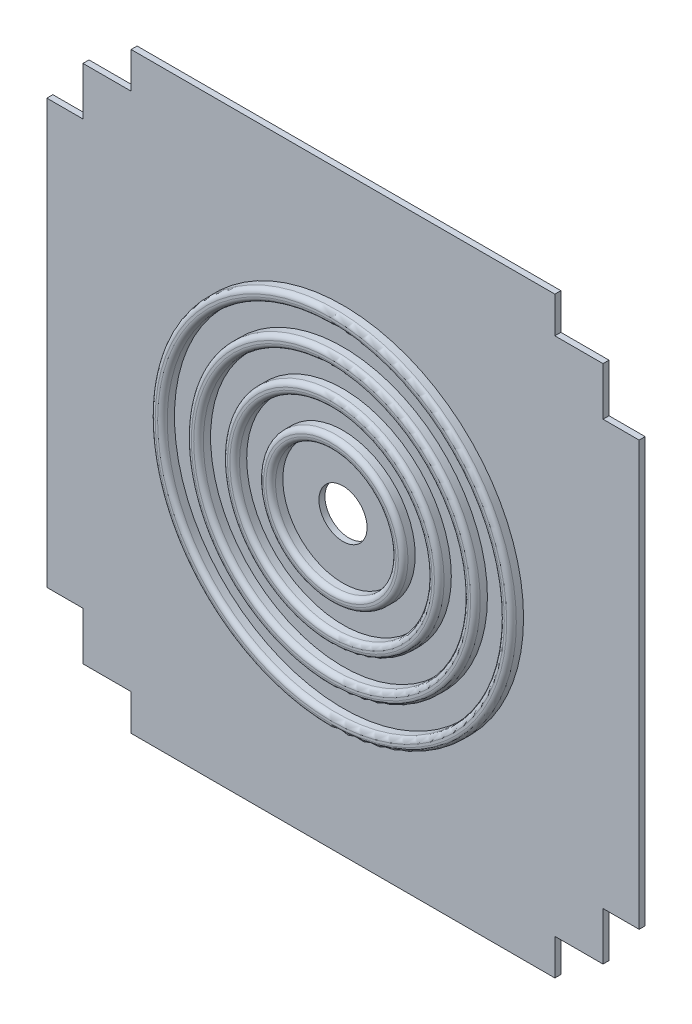
from build123d import *

# Parameters (mm, degrees)
SALIENTE_EXTRUIR1_DEPTH = 5
CROQUIS2_R              = 20
CORTAR_EXTRUIR1_DEPTH   = 10
CROQUIS3_R              = 150
CROQUIS3_R_2            = 140
CROQUIS3_R_3            = 120
CROQUIS3_R_4            = 110
CROQUIS3_R_5            = 90
CROQUIS3_R_6            = 80
CROQUIS3_R_7            = 60
CROQUIS3_R_8            = 50
SALIENTE_EXTRUIR2_DEPTH = 10
REDONDEO1_R             = 4


with BuildPart() as part:
    # Croquis1 → Saliente-Extruir1 (new body)
    with BuildSketch(Plane.XY):
        Polygon((-246, 176), (-246, -176), (-216, -176), (-216, -216), (-176, -216), (-176, -246), (176, -246), (176, -216), (216, -216), (216, -176), (246, -176), (246, 176), (216, 176), (216, 216), (176, 216), (176, 246), (-176, 246), (-176, 216), (-216, 216), (-216, 176), align=None)
    extrude(amount=SALIENTE_EXTRUIR1_DEPTH)

    # Croquis2 → Cortar-Extruir1 (cut)
    with BuildSketch(Plane.XY.offset(5)):
        Circle(CROQUIS2_R)
    extrude(amount=-CORTAR_EXTRUIR1_DEPTH, mode=Mode.SUBTRACT)

    # Croquis3 → Saliente-Extruir2 (add)
    # profile 1 of 4: a face of its own
    with BuildSketch(Plane.XY.offset(5)):
        Circle(CROQUIS3_R)
        Circle(CROQUIS3_R_2, mode=Mode.SUBTRACT)
    # profile 2 of 4: a face of its own
    with BuildSketch(Plane.XY.offset(5)):
        Circle(CROQUIS3_R_3)
        Circle(CROQUIS3_R_4, mode=Mode.SUBTRACT)
    # profile 3 of 4: a face of its own
    with BuildSketch(Plane.XY.offset(5)):
        Circle(CROQUIS3_R_5)
        Circle(CROQUIS3_R_6, mode=Mode.SUBTRACT)
    # profile 4 of 4: a face of its own
    with BuildSketch(Plane.XY.offset(5)):
        Circle(CROQUIS3_R_7)
        Circle(CROQUIS3_R_8, mode=Mode.SUBTRACT)
    extrude(amount=SALIENTE_EXTRUIR2_DEPTH)

    # Redondeo1
    redondeo1_edges = [part.edges().sort_by_distance(p)[0] for p in [
        (-50, 0, 15),
        (-60, 0, 15),
        (-80, 0, 15),
        (-90, 0, 15),
        (-110, 0, 15),
        (-120, 0, 15),
        (-140, 0, 15),
        (-150, 0, 15),
    ]]
    fillet(redondeo1_edges, radius=REDONDEO1_R)


solid = part.part
